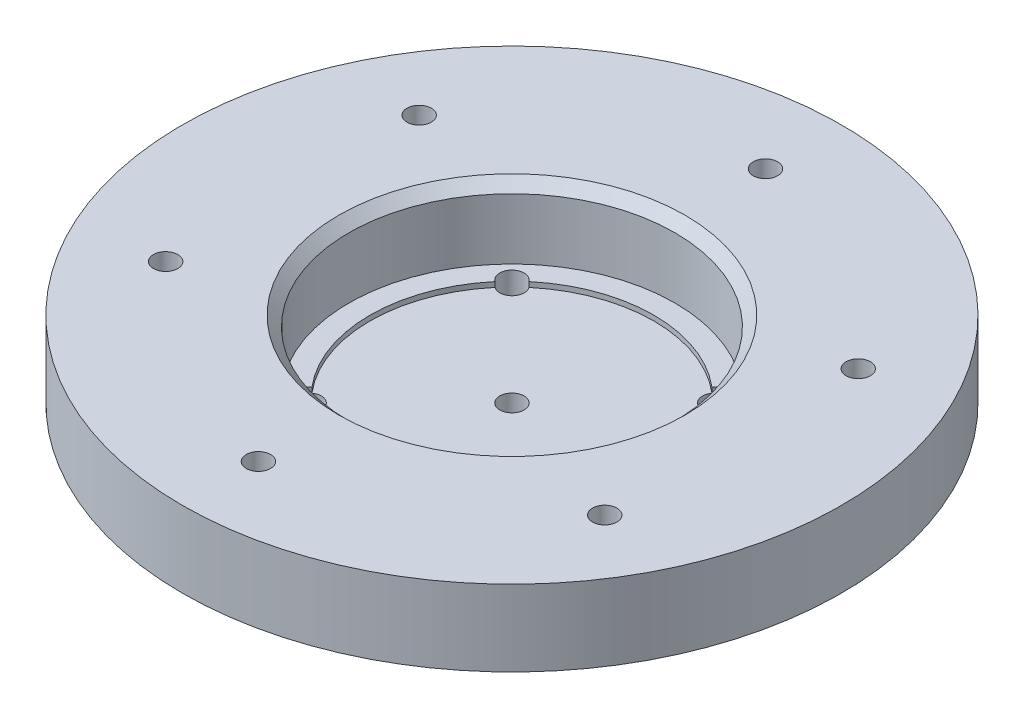
from build123d import *

# Parameters (mm, degrees)
F_2_4_2_4_DURCHMESSER_BOHRUNG1_D = 2.4
KREISMUSTER1_COUNT               = 6
F_2_4_2_4_DURCHMESSER_BOHRUNG2_D = 2.4
FASE1_SIZE                       = 1
FASE2_SIZE                       = 1


with BuildPart() as part:
    # Skizze1 → Rotation1 (revolve)
    with BuildSketch(Plane.XY):
        Polygon((0, 0), (20, 0), (20, 7.5), (32.5, 7.5), (32.5, 15), (16.075, 15), (16.075, 8), (14, 8), (14, 7.5), (0, 7.5), align=None)
    revolve(axis=Axis((0, 0, 0), (0, -1, 0)))

    # Ø2.4 (2.4) Durchmesser Bohrung1 (through all)
    with Locations(Plane(origin=(0, 15, 0), x_dir=(1, 0, 0), z_dir=(0, 1, 0))):
        with Locations((0, 25)):
            f_2_4_2_4_durchmesser_bohrung1 = Hole(F_2_4_2_4_DURCHMESSER_BOHRUNG1_D / 2)

    # Kreismuster1: Ø2.4 (2.4) Durchmesser Bohrung1 ×6 about axis
    kreismuster1_axis = Axis((0, 15, 0), (0, 1, 0))
    for i in range(1, KREISMUSTER1_COUNT):
        add(f_2_4_2_4_durchmesser_bohrung1.rotate(kreismuster1_axis, i * 360 / KREISMUSTER1_COUNT), mode=Mode.SUBTRACT)

    # Ø2.4 (2.4) Durchmesser Bohrung2 (through all)
    with Locations(Plane(origin=(0, 0, 0), x_dir=(-1, 0, 0), z_dir=(0, -1, 0))):
        with Locations((0, 0), (10, 10), (-10, -10), (-10, 10), (10, -10)):
            Hole(F_2_4_2_4_DURCHMESSER_BOHRUNG2_D / 2)

    # Fase1
    fase1_edges = [part.edges().sort_by_distance(p)[0] for p in [
        (-16.075, 15, 0),
    ]]
    chamfer(fase1_edges, length=FASE1_SIZE)

    # Fase2
    fase2_edges = [part.edges().sort_by_distance(p)[0] for p in [
        (-20, 0, 0),
    ]]
    chamfer(fase2_edges, length=FASE2_SIZE)


solid = part.part
